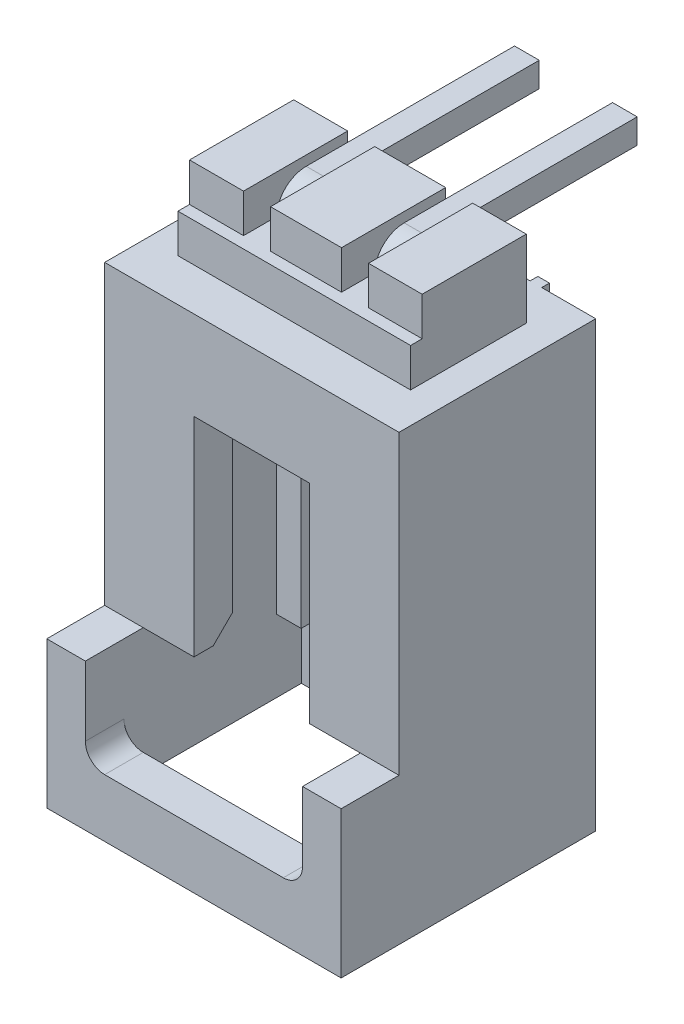
from build123d import *

# Parameters (mm, degrees)
EXTRUDE_START                      = 0.2
EXTRUDE_1_DEPTH                    = 5.1
SKETCH_7_W                         = 0.3
SKETCH_7_H                         = 0.2
EXTRUDE_4_DEPTH                    = 11.5
SKETCH_8_W                         = 1
SKETCH_8_H                         = 2
CUT_EXTRUDE_5_DEPTH                = 6.03
CUT_EXTRUDE_1_DEPTH                = 9.2
EXTRUDE_2_DEPTH                    = 3.8
SKETCH_4_W                         = 5.63
SKETCH_4_H                         = 1
CUT_EXTRUDE_2_DEPTH                = 3.8
CUT_EXTRUDE_3_REACH                = 17.116
CHAMFER_1_SIZE                     = 0.5
CUT_EXTRUDE_6_REACH                = 16.052
SKETCH_9_W                         = 0.7
SKETCH_9_H                         = 1
SWEEP_START                        = 0.95
SWEEP_1_DEPTH                      = 0.64
CHAMFER_2_SIZE                     = 0.2
PATTERN_LINEAR_2_COUNT             = 2
PATTERN_LINEAR_2_PITCH             = 2.54
PATTERN_LINEAR_1_COUNT             = 2
PATTERN_LINEAR_1_PITCH             = 2.54
CHAMFER_2_OF_PATTERN_LINEAR_1_SIZE = 0.2


# Read off the part's stored shape, not the designer's step: По траектории1
with BuildPart() as part:
    # Эскиз1 → Бобышка-Вытянуть1 (new body)
    with BuildSketch(Plane.XY.offset(EXTRUDE_START)):
        Polygon((-3.015, 0.55), (3.015, 0.55), (3.015, -1.45), (3.815, -1.45), (3.815, -12.95), (-3.815, -12.95), (-3.815, -1.45), (-3.015, -1.45), align=None)
    extrude(amount=EXTRUDE_1_DEPTH)

    # Эскиз7 → Бобышка-Вытянуть4 (add)
    with BuildSketch(Plane.XZ.offset(12.95)):
        with Locations((2.265, 0.1)):
            Rectangle(SKETCH_7_W, SKETCH_7_H)
        with Locations((-2.265, 0.1)):
            Rectangle(SKETCH_7_W, SKETCH_7_H)
    extrude(amount=-EXTRUDE_4_DEPTH)

    # Эскиз8 → Вырез-Вытянуть5 (cut)
    with BuildSketch(Plane(origin=(3.015, 0, 0), x_dir=(0, 0, -1), z_dir=(1, 0, 0))):
        with Locations((-0.7, -0.45)):
            Rectangle(SKETCH_8_W, SKETCH_8_H)
        Polygon((-4.2, -1.45), (-5.3, -1.45), (-5.3, 0.55), (-3.9, 0.55), (-3.9, -0.45), (-4.2, -0.45), align=None)
    extrude(amount=-CUT_EXTRUDE_5_DEPTH, mode=Mode.SUBTRACT)

    # Эскиз2 → Вырез-Вытянуть1 (cut)
    with BuildSketch(Plane.XZ.offset(12.95)):
        Polygon((-2.815, 4.3), (-2.815, 1.2), (-0.6, 1.2), (-0.6, 0.2), (0.6, 0.2), (0.6, 1.2), (2.815, 1.2), (2.815, 4.3), (1.5, 4.3), (1.5, 5.3), (-1.5, 5.3), (-1.5, 4.3), align=None)
    extrude(amount=-CUT_EXTRUDE_1_DEPTH, mode=Mode.SUBTRACT)

    # Эскиз3 → Бобышка-Вытянуть2 (add)
    with BuildSketch(Plane.XZ.offset(12.95)):
        Polygon((-3.815, 5.3), (-3.815, 6.8), (3.815, 6.8), (3.815, 5.3), (2.815, 5.3), (2.815, 5.8), (-2.815, 5.8), (-2.815, 5.3), align=None)
    extrude(amount=-EXTRUDE_2_DEPTH)

    # Эскиз4 → Вырез-Вытянуть2 (cut)
    with BuildSketch(Plane.XZ.offset(12.95)):
        with Locations((0, 4.8)):
            Rectangle(SKETCH_4_W, SKETCH_4_H)
    extrude(amount=-CUT_EXTRUDE_2_DEPTH, mode=Mode.SUBTRACT)

    # Эскиз5 → Вырез-Вытянуть3 (cut, up to next)
    with BuildSketch(Plane.XY.offset(6.8), mode=Mode.PRIVATE) as cut_extrude_3_sk1:
        with BuildLine():
            Line((2.815, -9.15), (2.815, -10.95))
            ThreePointArc((2.815, -10.95), (2.668553391, -11.303553391), (2.315, -11.45))
            Line((2.315, -11.45), (-2.315, -11.45))
            ThreePointArc((-2.315, -11.45), (-2.668553391, -11.303553391), (-2.815, -10.95))
            Line((-2.815, -10.95), (-2.815, -9.15))
            Line((-2.815, -9.15), (2.815, -9.15))
        make_face()
    cut_extrude_3_tool1 = extrude(cut_extrude_3_sk1.sketch, amount=-CUT_EXTRUDE_3_REACH, mode=Mode.PRIVATE) & part.part
    add(cut_extrude_3_tool1.solids().sort_by_distance((0, -10.291324, 6.8))[0], mode=Mode.SUBTRACT)

    # Фаска1
    chamfer_1_edges = [part.edges().sort_by_distance(p)[0] for p in [
        (0, -12.95, 5.8),
        (-2.1575, -9.15, 4.3),
        (2.1575, -9.15, 4.3),
        (-2.815, -12.95, 3.5),
        (-1.7075, -12.95, 1.2),
        (1.7075, -12.95, 1.2),
        (2.815, -12.95, 3.5),
    ]]
    chamfer(chamfer_1_edges, length=CHAMFER_1_SIZE)

    # Эскиз9 → Вырез-Вытянуть6 (cut, up to next)
    with BuildSketch(Plane.XY.offset(3.9), mode=Mode.PRIVATE) as cut_extrude_6_sk1:
        with Locations((1.275, 0.05)):
            Rectangle(SKETCH_9_W, SKETCH_9_H)
    cut_extrude_6_tool1 = extrude(cut_extrude_6_sk1.sketch, amount=-CUT_EXTRUDE_6_REACH, mode=Mode.PRIVATE) & part.part
    cut_extrude_6 = cut_extrude_6_tool1.solids().sort_by_distance((1.275, 0.05, 3.9))[0]
    add(cut_extrude_6, mode=Mode.SUBTRACT)

    # По траектории1 outline → По траектории1 (add)
    with BuildSketch(Plane.YZ.offset(SWEEP_START)):
        with BuildLine():
            Line((-3.75, 2.43), (-3.75, 3.07))
            add(Edge.make_bspline(
                [(-3.75, 3.07), (-4.166666667, 3.07), (-4.583333333, 3.07), (-6.516666667, 3.07), (-8.033333333, 3.07), (-9.55, 3.07)],
                knots=[0.623544277, 0.623544277, 0.623544277, 0.623544277, 0.704676976, 0.704676976, 1, 1, 1, 1], degree=3))
            Line((-9.55, 3.07), (-9.55, 2.43))
            Line((-9.55, 2.43), (-3.75, 2.43))
        make_face()
        with BuildLine():
            Line((0.32, -3.3), (0.32, 2.3))
            add(Edge.make_bspline(
                [(0.32, 2.3), (0.32, 2.499654349), (0.23877091, 2.700173533), (0.022322877, 2.916621566), (-0.064240468, 2.973940923), (-0.250203983, 3.050392149), (-0.370157621, 3.069944018), (-0.45, 3.07)],
                knots=[0.363474491, 0.363474491, 0.363474491, 0.363474491, 0.386414221, 0.386414221, 0.397884087, 0.397884087, 0.409353952, 0.409353952, 0.409353952, 0.409353952], degree=3))
            Line((-0.45, 3.07), (-0.45, 2.43))
            ThreePointArc((-0.45, 2.43), (-0.358076118, 2.391923882), (-0.32, 2.3))
            Line((-0.32, 2.3), (-0.32, -3.3))
            Line((-0.32, -3.3), (0.32, -3.3))
        make_face()
    sweep_1 = extrude(amount=SWEEP_1_DEPTH)

    # Фаска2
    chamfer_2_edges = [part.edges().sort_by_distance(p)[0] for p in [
        (1.27, -9.55, 3.07),
        (1.59, -9.55, 2.75),
        (1.27, -9.55, 2.43),
        (0.95, -9.55, 2.75),
        (1.27, -0.32, -3.3),
        (1.59, 0, -3.3),
        (1.27, 0.32, -3.3),
        (0.95, 0, -3.3),
    ]]
    chamfer(chamfer_2_edges, length=CHAMFER_2_SIZE)

    # Линейный массив2: Вырез-Вытянуть6 ×2
    with Locations(*[(-i * PATTERN_LINEAR_2_PITCH, 0, 0) for i in range(1, PATTERN_LINEAR_2_COUNT)]):
        add(cut_extrude_6, mode=Mode.SUBTRACT)

    # Линейный массив1: По траектории1 ×2
    with Locations(*[(-i * PATTERN_LINEAR_1_PITCH, 0, 0) for i in range(1, PATTERN_LINEAR_1_COUNT)]):
        add(sweep_1)

    # Фаска2 of Линейный массив1
    chamfer_2_of_pattern_linear_1_edges = [part.edges().sort_by_distance(p)[0] for p in [
        (-1.27, -9.55, 3.07),
        (-0.95, -9.55, 2.75),
        (-1.27, -9.55, 2.43),
        (-1.59, -9.55, 2.75),
        (-1.27, -0.32, -3.3),
        (-0.95, 0, -3.3),
        (-1.27, 0.32, -3.3),
        (-1.59, 0, -3.3),
    ]]
    chamfer(chamfer_2_of_pattern_linear_1_edges, length=CHAMFER_2_OF_PATTERN_LINEAR_1_SIZE)


solid = part.part
